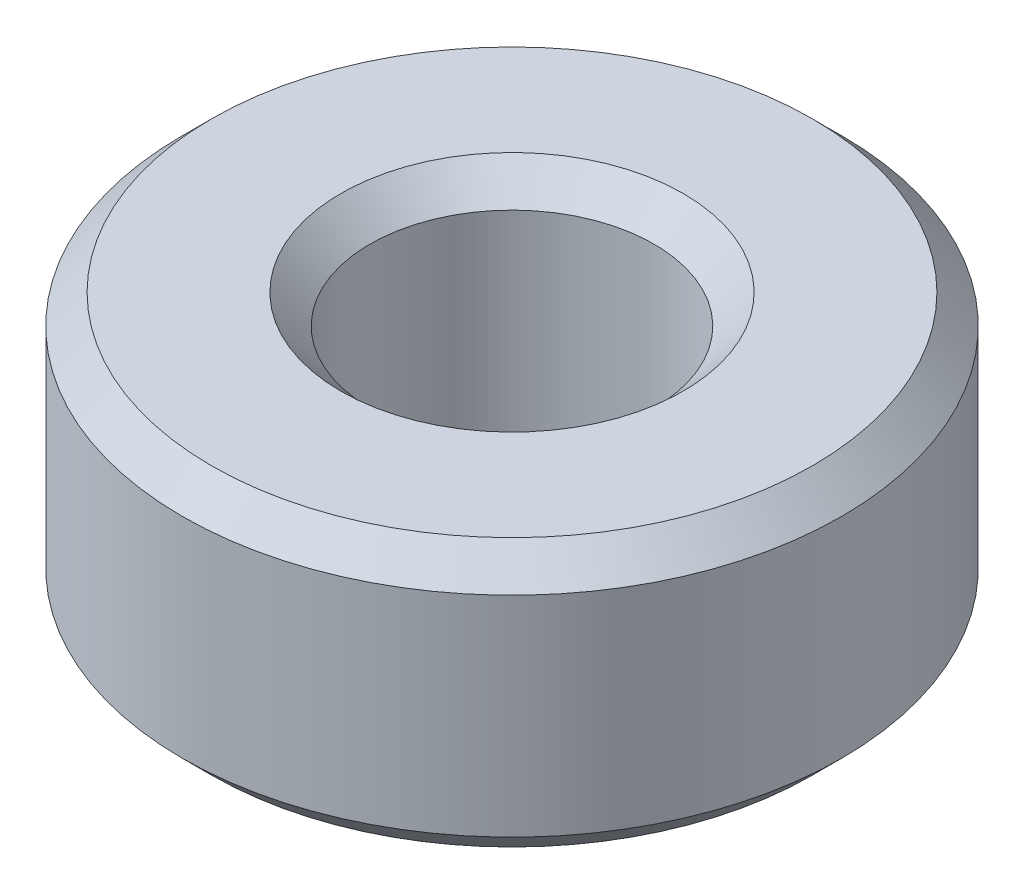
from build123d import *

# Parameters (mm, degrees)
SKETCH1_R           = 40
BOSS_EXTRUDE1_DEPTH = 32.505722741
SKETCH2_R           = 17.228740717
CUT_EXTRUDE1_DEPTH  = 66.242792789
CHAMFER1_SIZE       = 3.544880842


with BuildPart() as part:
    # Sketch1 → Boss-Extrude1 (new body)
    with BuildSketch(Plane(origin=(0, 0, 0), x_dir=(1, 0, 0), z_dir=(0, 1, 0))):
        Circle(SKETCH1_R)
    extrude(amount=BOSS_EXTRUDE1_DEPTH)

    # Sketch2 → Cut-Extrude1 (cut, through all)
    with BuildSketch(Plane(origin=(0, 0, 0), x_dir=(1, 0, 0), z_dir=(0, 1, 0))):
        Circle(SKETCH2_R)
    extrude(amount=CUT_EXTRUDE1_DEPTH, mode=Mode.SUBTRACT)

    # Chamfer1
    chamfer1_edges = [part.edges().sort_by_distance(p)[0] for p in [
        (-17.228740717, 32.505722741, 0),
        (-17.228740717, 0, 0),
        (-40, 0, 0),
        (-40, 32.505722741, 0),
    ]]
    chamfer(chamfer1_edges, length=CHAMFER1_SIZE)


solid = part.part
